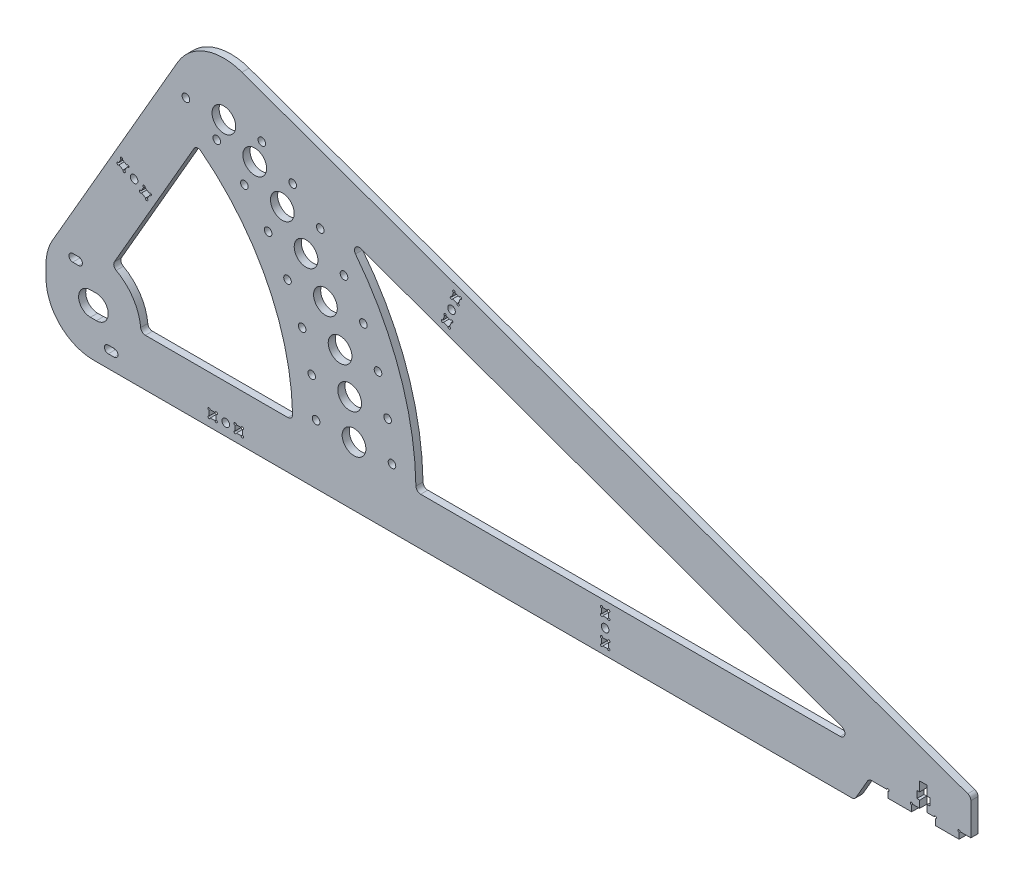
from build123d import *

# Parameters (mm, degrees)
BOSS_EXTRUDE1_DEPTH                   = 3
SKETCH9_R                             = 5
SKETCH9_R_2                           = 1.6
FLYWHEEL_MOUNTING_HOLES_DEPTH         = 389.300239182
FLYWHEEL_MOUNTING_PATTERN_OUTLINE_R   = 1.6
FLYWHEEL_MOUNTING_PATTERN_OUTLINE_R_2 = 5
FLYWHEEL_MOUNTING_PATTERN_DEPTH       = 3
CUT_EXTRUDE6_DEPTH                    = 389.300239182
CUT_EXTRUDE6_DEPTH_BACK               = 389.300239182
SKETCH11_R                            = 1.6
SKETCH11_W                            = 3
SKETCH11_H                            = 3
SKETCH12_R                            = 0.5
CUT_EXTRUDE7_DEPTH                    = 389.300239182


# Read off the part's stored shape, not the designer's step: Flywheel Mounting Pattern
with BuildPart() as part:
    # Sketch1 → Boss-Extrude1 (new body)
    with BuildSketch(Plane.XY):
        with BuildLine():
            Line((370, -9.5), (370, 4.095535739))
            ThreePointArc((370, 4.095535739), (369.63674563, 5.24491111), (368.678936257, 5.976770854))
            Line((368.678936257, 5.976770854), (62.638032889, 116.426689464))
            ThreePointArc((62.638032889, 116.426689464), (47.275857844, 116.395414414), (35.514428415, 106.512794416))
            Line((35.514428415, 106.512794416), (-17.320508076, 15))
            ThreePointArc((-17.320508076, 15), (-19.318516526, 10.176380902), (-20, 5))
            Line((-20, 5), (-20, 0))
            ThreePointArc((-20, 0), (-14.142135624, -14.142135624), (0, -20))
            Line((0, -20), (319.783121635, -20))
            ThreePointArc((319.783121635, -20), (320.783121635, -19.732050808), (321.515172443, -19))
            Line((321.515172443, -19), (326.422649731, -10.5))
            ThreePointArc((326.422649731, -10.5), (327.154700538, -9.767949192), (328.154700538, -9.5))
            Line((328.154700538, -9.5), (335, -9.5))
            Line((335, -9.5), (335, -12.5))
            Line((335, -12.5), (345, -12.5))
            Line((345, -12.5), (345, -9.5))
            Line((345, -9.5), (348.4, -9.5))
            Line((348.4, -9.5), (348.4, -6.5))
            Line((348.4, -6.5), (347.25, -6.5))
            Line((347.25, -6.5), (347.25, -3.5))
            Line((347.25, -3.5), (348.4, -3.5))
            Line((348.4, -3.5), (348.4, 0.5))
            Line((348.4, 0.5), (351.6, 0.5))
            Line((351.6, 0.5), (351.6, -3.5))
            Line((351.6, -3.5), (352.75, -3.5))
            Line((352.75, -3.5), (352.75, -6.5))
            Line((352.75, -6.5), (351.6, -6.5))
            Line((351.6, -6.5), (351.6, -9.5))
            Line((351.6, -9.5), (355, -9.5))
            Line((355, -9.5), (355, -12.5))
            Line((355, -12.5), (365, -12.5))
            Line((365, -12.5), (365, -9.5))
            Line((365, -9.5), (370, -9.5))
        make_face()
        with BuildLine():
            Line((-8.75, 14.590381057), (-6.25, 14.590381057))
            ThreePointArc((-6.25, 14.590381057), (-4.65, 12.990381057), (-6.25, 11.390381057))
            Line((-6.25, 11.390381057), (-8.75, 11.390381057))
            ThreePointArc((-8.75, 11.390381057), (-10.35, 12.990381057), (-8.75, 14.590381057))
        make_face(mode=Mode.SUBTRACT)
        with BuildLine():
            Line((6.25, -11.390381057), (8.75, -11.390381057))
            ThreePointArc((8.75, -11.390381057), (10.35, -12.990381057), (8.75, -14.590381057))
            Line((8.75, -14.590381057), (6.25, -14.590381057))
            ThreePointArc((6.25, -14.590381057), (4.65, -12.990381057), (6.25, -11.390381057))
        make_face(mode=Mode.SUBTRACT)
        with BuildLine():
            Line((-1.25, 5), (1.25, 5))
            ThreePointArc((1.25, 5), (6.25, 0), (1.25, -5))
            Line((1.25, -5), (-1.25, -5))
            ThreePointArc((-1.25, -5), (-6.25, 0), (-1.25, 5))
        make_face(mode=Mode.SUBTRACT)
    extrude(amount=BOSS_EXTRUDE1_DEPTH)

    # Sketch9 → Flywheel Mounting Holes (cut, symmetric)
    with BuildSketch(Plane.XY.offset(3)):
        with Locations((109.886304879, 5)):
            Circle(SKETCH9_R)
        with Locations((125.886304879, 5)):
            Circle(SKETCH9_R_2)
        with Locations((93.886304879, 5)):
            Circle(SKETCH9_R_2)
    extrude(amount=FLYWHEEL_MOUNTING_HOLES_DEPTH, both=True, mode=Mode.SUBTRACT)

    # Flywheel Mounting Pattern outline → Flywheel Mounting Pattern (cut)
    with BuildSketch(Plane.XY):
        with Locations((88.004698606, 35.819305799)):
            Circle(FLYWHEEL_MOUNTING_PATTERN_OUTLINE_R)
        with Locations((113.833167598, 50.285895812)):
            Circle(FLYWHEEL_MOUNTING_PATTERN_OUTLINE_R)
        with Locations((97.833167598, 50.285895812)):
            Circle(FLYWHEEL_MOUNTING_PATTERN_OUTLINE_R_2)
        with Locations((81.833167598, 50.285895812)):
            Circle(FLYWHEEL_MOUNTING_PATTERN_OUTLINE_R)
        with Locations((104.004698606, 35.819305799)):
            Circle(FLYWHEEL_MOUNTING_PATTERN_OUTLINE_R_2)
        with Locations((120.004698606, 35.819305799)):
            Circle(FLYWHEEL_MOUNTING_PATTERN_OUTLINE_R)
        with Locations((92.049977998, 20.620432938)):
            Circle(FLYWHEEL_MOUNTING_PATTERN_OUTLINE_R)
        with Locations((108.049977998, 20.620432938)):
            Circle(FLYWHEEL_MOUNTING_PATTERN_OUTLINE_R_2)
        with Locations((68.023791658, 86.445148901)):
            Circle(FLYWHEEL_MOUNTING_PATTERN_OUTLINE_R_2)
        with Locations((84.023791658, 86.445148901)):
            Circle(FLYWHEEL_MOUNTING_PATTERN_OUTLINE_R)
        with Locations((63.656918291, 75.860235753)):
            Circle(FLYWHEEL_MOUNTING_PATTERN_OUTLINE_R)
        with Locations((79.656918291, 75.860235753)):
            Circle(FLYWHEEL_MOUNTING_PATTERN_OUTLINE_R_2)
        with Locations((105.661554543, 63.724450856)):
            Circle(FLYWHEEL_MOUNTING_PATTERN_OUTLINE_R)
        with Locations((89.661554543, 63.724450856)):
            Circle(FLYWHEEL_MOUNTING_PATTERN_OUTLINE_R_2)
        with Locations((73.661554543, 63.724450856)):
            Circle(FLYWHEEL_MOUNTING_PATTERN_OUTLINE_R)
        with Locations((95.656918291, 75.860235753)):
            Circle(FLYWHEEL_MOUNTING_PATTERN_OUTLINE_R)
        with Locations((39, 95.262794416)):
            Circle(FLYWHEEL_MOUNTING_PATTERN_OUTLINE_R)
        with Locations((55, 95.262794416)):
            Circle(FLYWHEEL_MOUNTING_PATTERN_OUTLINE_R_2)
        with Locations((71, 95.262794416)):
            Circle(FLYWHEEL_MOUNTING_PATTERN_OUTLINE_R)
        with Locations((52.023791658, 86.445148901)):
            Circle(FLYWHEEL_MOUNTING_PATTERN_OUTLINE_R)
        with Locations((124.049977998, 20.620432938)):
            Circle(FLYWHEEL_MOUNTING_PATTERN_OUTLINE_R)
    extrude(amount=FLYWHEEL_MOUNTING_PATTERN_DEPTH, mode=Mode.SUBTRACT)

    # Sketch11 → Cut-Extrude6 (cut, two sides: drawn at the far end of the back side and taken through both)
    with BuildSketch(Plane.XY.offset(3).offset(-CUT_EXTRUDE6_DEPTH_BACK)):
        Polygon((22.472092576, 49.922806094), (19.874016364, 51.422806094), (21.374016364, 54.020882305), (23.972092576, 52.520882305), align=None)
        with Locations((17.159914749, 54.721844199)):
            Circle(SKETCH11_R)
        Polygon((14.445813134, 58.020882305), (12.945813134, 55.422806094), (10.347736923, 56.922806094), (11.847736923, 59.520882305), align=None)
        Polygon((148.235586531, 70.650761743), (151.057439204, 69.632357358), (150.039034818, 66.810504685), (147.217182145, 67.82890907), align=None)
        with Locations((151.004385381, 73.904029781)):
            Circle(SKETCH11_R)
        Polygon((150.951331558, 78.175702205), (151.969735943, 80.997554878), (154.791588616, 79.979150492), (153.773184231, 77.157297819), align=None)
        with BuildLine():
            ThreePointArc((9.603769111, 17.543306953), (8.638301753, 18.758078708), (8.832095214, 20.297637649))
            Line((8.832095214, 20.297637649), (42.377717639, 78.400360059))
            ThreePointArc((42.377717639, 78.400360059), (43.725293361, 79.363056905), (45.336498415, 78.979959244))
            ThreePointArc((45.336498415, 78.979959244), (73.362153081, 44.882130037), (83.979173175, 2.040816327))
            ThreePointArc((83.979173175, 2.040816327), (83.40816114, 0.600291576), (81.979589711, 0))
            Line((81.979589711, 0), (21.9089023, 0))
            ThreePointArc((21.9089023, 0), (20.560502575, 0.522902108), (19.917183909, 1.818181818))
            ThreePointArc((19.917183909, 1.818181818), (16.723981492, 10.96852055), (9.603769111, 17.543306953))
        make_face()
        with BuildLine():
            Line((137.983605456, 0), (314.890736473, 0))
            ThreePointArc((314.890736473, 0), (316.860821526, 1.655377185), (315.56967273, 3.881235115))
            Line((315.56967273, 3.881235115), (112.747772672, 77.079497528))
            ThreePointArc((112.747772672, 77.079497528), (110.448674018, 76.370897823), (110.493937457, 73.965504012))
            ThreePointArc((110.493937457, 73.965504012), (129.119942532, 40.048453174), (135.983874219, 1.967213115))
            ThreePointArc((135.983874219, 1.967213115), (136.581031709, 0.574241646), (137.983605456, 0))
        make_face()
        with Locations((215.77747388, -15.5)):
            Rectangle(SKETCH11_W, SKETCH11_H)
        with Locations((215.77747388, -10)):
            Circle(SKETCH11_R)
        with Locations((215.77747388, -4.5)):
            Rectangle(SKETCH11_W, SKETCH11_H)
        with Locations((61.27747388, -15)):
            Rectangle(SKETCH11_W, SKETCH11_H)
        with Locations((55.77747388, -15)):
            Circle(SKETCH11_R)
        with Locations((50.27747388, -15)):
            Rectangle(SKETCH11_W, SKETCH11_H)
    extrude(amount=CUT_EXTRUDE6_DEPTH + CUT_EXTRUDE6_DEPTH_BACK, mode=Mode.SUBTRACT)

    # Sketch12 → Cut-Extrude7 (cut, through all)
    with BuildSketch(Plane.XY.offset(3)):
        with Locations((335, -9.5)):
            Circle(SKETCH12_R)
        with Locations((345, -9.5)):
            Circle(SKETCH12_R)
        with Locations((355, -9.5)):
            Circle(SKETCH12_R)
        with Locations((365, -9.5)):
            Circle(SKETCH12_R)
        with Locations((12.945813134, 55.422806094)):
            Circle(SKETCH12_R)
        with Locations((10.347736923, 56.922806094)):
            Circle(SKETCH12_R)
        with Locations((11.847736923, 59.520882305)):
            Circle(SKETCH12_R)
        with Locations((14.445813134, 58.020882305)):
            Circle(SKETCH12_R)
        with Locations((19.874016364, 51.422806094)):
            Circle(SKETCH12_R)
        with Locations((21.374016364, 54.020882305)):
            Circle(SKETCH12_R)
        with Locations((23.972092576, 52.520882305)):
            Circle(SKETCH12_R)
        with Locations((22.472092576, 49.922806094)):
            Circle(SKETCH12_R)
        with Locations((147.217182145, 67.82890907)):
            Circle(SKETCH12_R)
        with Locations((150.039034818, 66.810504685)):
            Circle(SKETCH12_R)
        with Locations((151.057439204, 69.632357358)):
            Circle(SKETCH12_R)
        with Locations((148.235586531, 70.650761743)):
            Circle(SKETCH12_R)
        with Locations((151.969735943, 80.997554878)):
            Circle(SKETCH12_R)
        with Locations((154.791588616, 79.979150492)):
            Circle(SKETCH12_R)
        with Locations((153.773184231, 77.157297819)):
            Circle(SKETCH12_R)
        with Locations((150.951331558, 78.175702205)):
            Circle(SKETCH12_R)
        with Locations((214.27747388, -3)):
            Circle(SKETCH12_R)
        with Locations((217.27747388, -3)):
            Circle(SKETCH12_R)
        with Locations((217.27747388, -6)):
            Circle(SKETCH12_R)
        with Locations((214.27747388, -6)):
            Circle(SKETCH12_R)
        with Locations((214.27747388, -14)):
            Circle(SKETCH12_R)
        with Locations((217.27747388, -14)):
            Circle(SKETCH12_R)
        with Locations((217.27747388, -17)):
            Circle(SKETCH12_R)
        with Locations((214.27747388, -17)):
            Circle(SKETCH12_R)
        with Locations((48.77747388, -13.5)):
            Circle(SKETCH12_R)
        with Locations((51.77747388, -13.5)):
            Circle(SKETCH12_R)
        with Locations((51.77747388, -16.5)):
            Circle(SKETCH12_R)
        with Locations((48.77747388, -16.5)):
            Circle(SKETCH12_R)
        with Locations((59.77747388, -16.5)):
            Circle(SKETCH12_R)
        with Locations((62.77747388, -16.5)):
            Circle(SKETCH12_R)
        with Locations((62.77747388, -13.5)):
            Circle(SKETCH12_R)
        with Locations((59.77747388, -13.5)):
            Circle(SKETCH12_R)
    extrude(amount=-CUT_EXTRUDE7_DEPTH, mode=Mode.SUBTRACT)


solid = part.part
